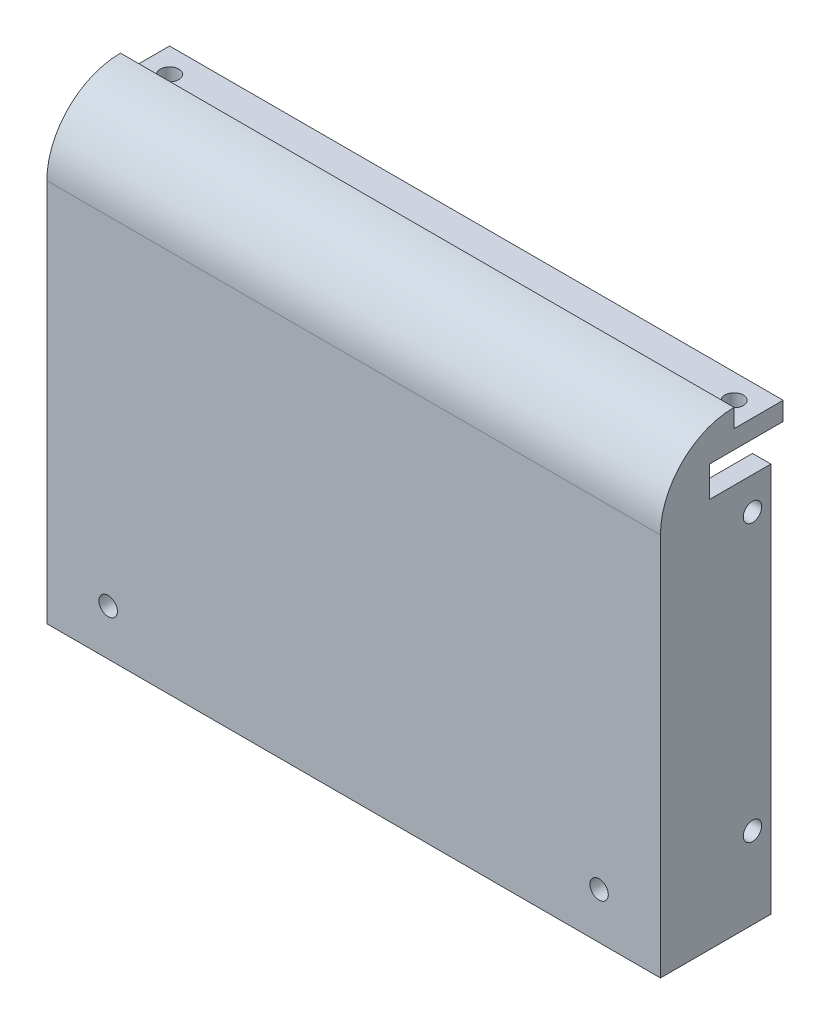
from build123d import *

# Parameters (mm, degrees)
SKETCH1_W           = 100
SKETCH1_H           = 20
BOSS_EXTRUDE1_DEPTH = 3
CUT_EXTRUDE1_REACH  = 53.078
SKETCH2_R           = 1.5
LPATTERN1_COUNT     = 2
LPATTERN1_PITCH     = 92
SKETCH3_W           = 100
SKETCH3_H           = 3
BOSS_EXTRUDE2_DEPTH = 68.54
SKETCH4_W           = 100
SKETCH4_H           = 5
BOSS_EXTRUDE3_DEPTH = 5
SKETCH5_W           = 100
SKETCH5_H           = 12
BOSS_EXTRUDE4_DEPTH = 3
FILLET4_R           = 12
SKETCH6_W           = 3
SKETCH6_H           = 63.54
BOSS_EXTRUDE5_DEPTH = 15
CUT_EXTRUDE2_REACH  = 123.646
SKETCH7_R           = 1.5
CUT_EXTRUDE3_REACH  = 89.165
SKETCH8_R           = 1.5
LPATTERN2_COUNT     = 2
LPATTERN2_PITCH     = 80


with BuildPart() as part:
    # Sketch1 → Boss-Extrude1 (new body)
    with BuildSketch(Plane(origin=(0, 0, 0), x_dir=(1, 0, 0), z_dir=(0, 1, 0))):
        Rectangle(SKETCH1_W, SKETCH1_H)
    extrude(amount=BOSS_EXTRUDE1_DEPTH)

    # Sketch2 → Cut-Extrude1 (cut, up to next)
    with BuildSketch(Plane(origin=(0, 3, 0), x_dir=(1, 0, 0), z_dir=(0, 1, 0)), mode=Mode.PRIVATE) as cut_extrude1_sk1:
        with Locations(Location((-46, 6, 0), (0, 0, 270))):
            Circle(SKETCH2_R)
    cut_extrude1_tool1 = extrude(cut_extrude1_sk1.sketch, amount=-CUT_EXTRUDE1_REACH, mode=Mode.PRIVATE) & part.part
    cut_extrude1 = cut_extrude1_tool1.solids().sort_by_distance((-46, 3, -6))[0]
    add(cut_extrude1, mode=Mode.SUBTRACT)

    # LPattern1: Cut-Extrude1 ×2
    with Locations(*[(i * LPATTERN1_PITCH, 0, 0) for i in range(1, LPATTERN1_COUNT)]):
        add(cut_extrude1, mode=Mode.SUBTRACT)

    # Sketch3 → Boss-Extrude2 (add)
    with BuildSketch(Plane.XZ):
        with Locations((0, 8.5)):
            Rectangle(SKETCH3_W, SKETCH3_H)
    extrude(amount=BOSS_EXTRUDE2_DEPTH)

    # Sketch4 → Boss-Extrude3 (add)
    with BuildSketch(Plane(origin=(0, 0, 7), x_dir=(-1, 0, 0), z_dir=(0, 0, -1))):
        with Locations((0, -2.5)):
            Rectangle(SKETCH4_W, SKETCH4_H)
    extrude(amount=BOSS_EXTRUDE3_DEPTH)

    # Sketch5 → Boss-Extrude4 (add)
    with BuildSketch(Plane(origin=(0, 3, 0), x_dir=(1, 0, 0), z_dir=(0, 1, 0))):
        with Locations((0, -4)):
            Rectangle(SKETCH5_W, SKETCH5_H)
    extrude(amount=BOSS_EXTRUDE4_DEPTH)

    # Fillet4
    fillet4_edges = [part.edges().sort_by_distance(p)[0] for p in [
        (0, 6, 10),
    ]]
    fillet(fillet4_edges, radius=FILLET4_R - 0.0001)  # a hair under: the kernel refuses the full size

    # Sketch6 → Boss-Extrude5 (add)
    with BuildSketch(Plane(origin=(0, 0, 7), x_dir=(-1, 0, 0), z_dir=(0, 0, -1))):
        with Locations((-48.5, -36.77)):
            Rectangle(SKETCH6_W, SKETCH6_H)
    extrude(amount=BOSS_EXTRUDE5_DEPTH)

    # Sketch7 → Cut-Extrude2 (cut, up to next)
    with BuildSketch(Plane(origin=(50, 0, 0), x_dir=(0, 0, -1), z_dir=(1, 0, 0)), mode=Mode.PRIVATE) as cut_extrude2_sk1:
        with Locations((5, -10.27)):
            Circle(SKETCH7_R)
    cut_extrude2_tool1 = extrude(cut_extrude2_sk1.sketch, amount=-CUT_EXTRUDE2_REACH, mode=Mode.PRIVATE) & part.part
    # Sketch7 → Cut-Extrude2 (cut, up to next)
    with BuildSketch(Plane(origin=(50, 0, 0), x_dir=(0, 0, -1), z_dir=(1, 0, 0)), mode=Mode.PRIVATE) as cut_extrude2_sk2:
        with Locations((5, -55.27)):
            Circle(SKETCH7_R)
    cut_extrude2_tool2 = extrude(cut_extrude2_sk2.sketch, amount=-CUT_EXTRUDE2_REACH, mode=Mode.PRIVATE) & part.part
    add(cut_extrude2_tool1.solids().sort_by_distance((50, -10.27, -5))[0], mode=Mode.SUBTRACT)
    add(cut_extrude2_tool2.solids().sort_by_distance((50, -55.27, -5))[0], mode=Mode.SUBTRACT)

    # Sketch8 → Cut-Extrude3 (cut, up to next)
    with BuildSketch(Plane.XY.offset(10), mode=Mode.PRIVATE) as cut_extrude3_sk1:
        with Locations((-40, -61.04)):
            Circle(SKETCH8_R)
    cut_extrude3_tool1 = extrude(cut_extrude3_sk1.sketch, amount=-CUT_EXTRUDE3_REACH, mode=Mode.PRIVATE) & part.part
    cut_extrude3 = cut_extrude3_tool1.solids().sort_by_distance((-40, -61.04, 10))[0]
    add(cut_extrude3, mode=Mode.SUBTRACT)

    # LPattern2: Cut-Extrude3 ×2
    with Locations(*[(i * LPATTERN2_PITCH, 0, 0) for i in range(1, LPATTERN2_COUNT)]):
        add(cut_extrude3, mode=Mode.SUBTRACT)


solid = part.part
